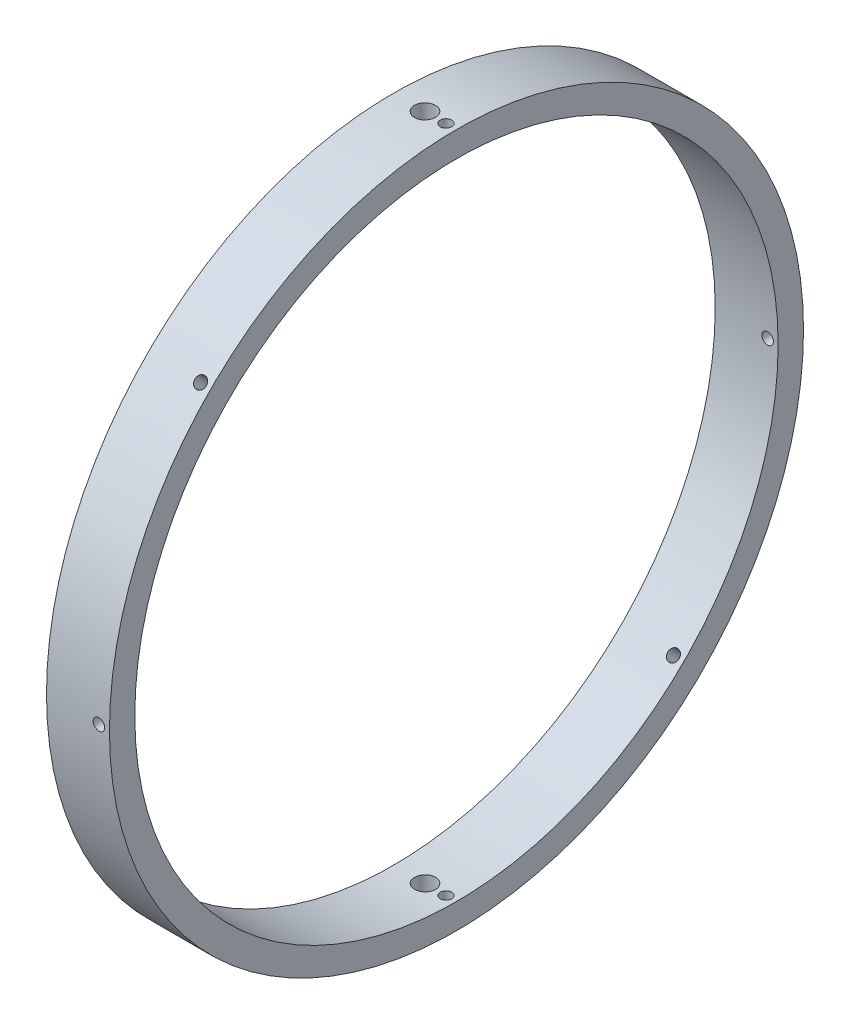
from build123d import *

# Parameters (mm, degrees)
MOUNT_SKETCH_W       = 18
MOUNT_SKETCH_H       = 7.25
PIN_HOLE_SKETCH_W    = 3
PIN_HOLE_SKETCH_H    = 9.25
PIN_HOLES_X2_COUNT   = 2
SCREW_HOLE_SKETCH_W  = 1.65
SCREW_HOLE_SKETCH_H  = 9.25
SCREW_HOLES_X8_COUNT = 8


with BuildPart() as part:
    # Mount Sketch → Mount (revolve)
    with BuildSketch(Plane.XY):
        with Locations((-48, 95.625)):
            Rectangle(MOUNT_SKETCH_W, MOUNT_SKETCH_H)
    revolve(axis=Axis((-108, 0, 0), (1, 0, 0)))

    # Pin Hole Sketch → Pin Hole (revolve, cut)
    with BuildSketch(Plane.XY):
        with Locations((-46.5, 95.625)):
            Rectangle(PIN_HOLE_SKETCH_W, PIN_HOLE_SKETCH_H)
    pin_hole = revolve(axis=Axis((-48, 82, 0), (0, 1, 0)), mode=Mode.SUBTRACT)

    # Pin Holes x2: Pin Hole ×2 about axis
    pin_holes_x2_axis = Axis((-38.1, 0, 0), (-1, 0, 0))
    for i in range(1, PIN_HOLES_X2_COUNT):
        add(pin_hole.rotate(pin_holes_x2_axis, i * 360 / PIN_HOLES_X2_COUNT), mode=Mode.SUBTRACT)

    # Screw Hole Sketch → Screw Hole (revolve, cut)
    with BuildSketch(Plane.XY):
        with Locations((-41.175, 95.625)):
            Rectangle(SCREW_HOLE_SKETCH_W, SCREW_HOLE_SKETCH_H)
    screw_hole = revolve(axis=Axis((-42, 82, 0), (0, 1, 0)), mode=Mode.SUBTRACT)

    # Screw Holes x8: Screw Hole ×8 about axis
    screw_holes_x8_axis = Axis((-38.1, 0, 0), (-1, 0, 0))
    for i in range(1, SCREW_HOLES_X8_COUNT):
        add(screw_hole.rotate(screw_holes_x8_axis, i * 360 / SCREW_HOLES_X8_COUNT), mode=Mode.SUBTRACT)


solid = part.part
